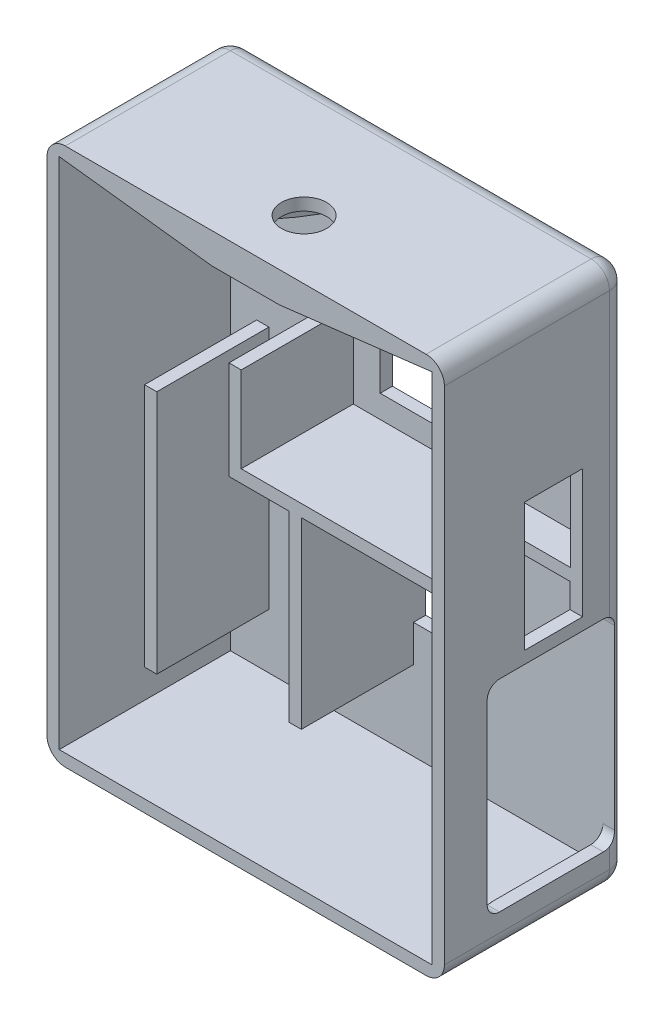
from build123d import *

# Parameters (mm, degrees)
SKETCH_1_W               = 65
SKETCH_1_H               = 30
EXTRUDE_1_DEPTH          = 88
SKETCH_4_W               = 2
SKETCH_4_H               = 40
CUT_EXTRUDE_1_DEPTH      = 28
CUT_EXTRUDE_2_DEPTH      = 6
SKETCH_7_W               = 4.182275868
SKETCH_7_H               = 9
CUT_EXTRUDE_3_DEPTH      = 6
SKETCH_8_W               = 12
SKETCH_8_H               = 11
CUT_EXTRUDE_4_DEPTH      = 6
FILLET_1_R               = 3
CUT_EXTRUDE_5_DEPTH      = 3
CUT_EXTRUDE_6_DEPTH      = 15
CUT_EXTRUDE_6_DEPTH_BACK = 6
SKETCH_12_W              = 10
SKETCH_12_H              = 9.5034376
CUT_EXTRUDE_8_DEPTH      = 5
CUT_EXTRUDE_8_DEPTH_BACK = 10
SKETCH_18_R              = 3.7
SKETCH_19_W              = 9.664954626
SKETCH_19_H              = 76.096771223
CUT_EXTRUDE_9_DEPTH      = 61


with BuildPart() as part:
    # 草图1 → 凸台-拉伸1 (new body)
    with BuildSketch(Plane(origin=(0, 0, 0), x_dir=(1, 0, 0), z_dir=(0, 1, 0))):
        Rectangle(SKETCH_1_W, SKETCH_1_H)
    extrude(amount=EXTRUDE_1_DEPTH)

    # 草图4 → 切除-拉伸1 (cut)
    with BuildSketch(Plane.XY.offset(15)):
        Polygon((-30.5, 86), (-30.5, 2), (-18.5, 2), (-9.5, 2), (30.439417497, 2), (30.439417497, 45), (-0.560582503, 45), (-0.560582503, 15), (-2.560582503, 15), (-2.560582503, 44.909852699), (-12.396150881, 44.909852699), (-12.396150881, 61), (-10.396150881, 61), (-10.396150881, 47), (24.5, 47), (30.5, 47), (30.5, 48.635726891), (30.5, 59.903593532), (30.5, 86), (5.5, 83), (-5.5, 83), align=None)
        with Locations((-25.206585503, 31)):
            Rectangle(SKETCH_4_W, SKETCH_4_H, mode=Mode.SUBTRACT)
    extrude(amount=-CUT_EXTRUDE_1_DEPTH, mode=Mode.SUBTRACT)

    # 草图6 → 切除-拉伸2 (cut)
    with BuildSketch(Plane(origin=(32.5, 0, 0), x_dir=(0, 0, -1), z_dir=(1, 0, 0))):
        with BuildLine():
            Line((13, 37), (13, 8))
            ThreePointArc((13, 8), (12.414213562, 6.585786438), (11, 6))
            Line((11, 6), (-6, 6))
            ThreePointArc((-6, 6), (-7.414213562, 6.585786438), (-8, 8))
            Line((-8, 8), (-8, 37))
            ThreePointArc((-8, 37), (-7.414213562, 38.414213562), (-6, 39))
            Line((-6, 39), (11, 39))
            ThreePointArc((11, 39), (12.414213562, 38.414213562), (13, 37))
        make_face()
    extrude(amount=-CUT_EXTRUDE_2_DEPTH, mode=Mode.SUBTRACT)

    # 草图7 → 切除-拉伸3 (cut)
    with BuildSketch(Plane.XY.offset(-13)):
        with Locations((1.530555431, 25.5)):
            Rectangle(SKETCH_7_W, SKETCH_7_H)
    extrude(amount=-CUT_EXTRUDE_3_DEPTH, mode=Mode.SUBTRACT)

    # 草图8 → 切除-拉伸4 (cut)
    with BuildSketch(Plane.XY.offset(-13)):
        with Locations((0, 56.224480757)):
            Rectangle(SKETCH_8_W, SKETCH_8_H)
    extrude(amount=-CUT_EXTRUDE_4_DEPTH, mode=Mode.SUBTRACT)

    # 圆角1
    # the kernel refuses this fillet: 3 mm, written as the material it takes off along each edge
    with BuildSketch(Plane(origin=(29.5, 3, -12), x_dir=(0, -1, 0), z_dir=(0, 0, -1))) as fillet_1_piece_1_section:
        Polygon((0, 0), (FILLET_1_R, 0), (FILLET_1_R, -FILLET_1_R), (0, -FILLET_1_R), align=None)
    fillet_1_piece_1 = extrude(amount=FILLET_1_R, mode=Mode.PRIVATE)
    fillet_1_piece_1 = fillet_1_piece_1 - Plane(origin=(29.5, 3, -12), x_dir=(-0.7071067811865475, 0.7071067811865475, 0), z_dir=(0, 0, -1)) * Sphere(FILLET_1_R, mode=Mode.PRIVATE)
    add(fillet_1_piece_1, mode=Mode.SUBTRACT)
    with BuildSketch(Plane(origin=(29.5, 85, -12), x_dir=(0, 1, 0), z_dir=(0, 0, -1))) as fillet_1_piece_2_section:
        Polygon((0, 0), (FILLET_1_R, 0), (FILLET_1_R, FILLET_1_R), (0, FILLET_1_R), align=None)
    fillet_1_piece_2 = extrude(amount=FILLET_1_R, mode=Mode.PRIVATE)
    fillet_1_piece_2 = fillet_1_piece_2 - Plane(origin=(29.5, 85, -12), x_dir=(-0.7071067811865475, -0.7071067811865475, 0), z_dir=(0, 0, -1)) * Sphere(FILLET_1_R, mode=Mode.PRIVATE)
    add(fillet_1_piece_2, mode=Mode.SUBTRACT)
    with BuildSketch(Plane(origin=(-29.5, 3, -12), x_dir=(-1, 0, 0), z_dir=(0, 0, -1))) as fillet_1_piece_3_section:
        Polygon((0, 0), (FILLET_1_R, 0), (FILLET_1_R, -FILLET_1_R), (0, -FILLET_1_R), align=None)
    fillet_1_piece_3 = extrude(amount=FILLET_1_R, mode=Mode.PRIVATE)
    fillet_1_piece_3 = fillet_1_piece_3 - Plane(origin=(-29.5, 3, -12), x_dir=(0.7071067811865475, 0.7071067811865475, 0), z_dir=(0, 0, -1)) * Sphere(FILLET_1_R, mode=Mode.PRIVATE)
    add(fillet_1_piece_3, mode=Mode.SUBTRACT)
    with BuildSketch(Plane(origin=(-29.5, 85, -12), x_dir=(-1, 0, 0), z_dir=(0, 0, -1))) as fillet_1_piece_4_section:
        Polygon((0, 0), (FILLET_1_R, 0), (FILLET_1_R, FILLET_1_R), (0, FILLET_1_R), align=None)
    fillet_1_piece_4 = extrude(amount=FILLET_1_R, mode=Mode.PRIVATE)
    fillet_1_piece_4 = fillet_1_piece_4 - Plane(origin=(-29.5, 85, -12), x_dir=(0.7071067811865475, -0.7071067811865475, 0), z_dir=(0, 0, -1)) * Sphere(FILLET_1_R, mode=Mode.PRIVATE)
    add(fillet_1_piece_4, mode=Mode.SUBTRACT)
    with BuildSketch(Plane(origin=(32.5, 3, -15), x_dir=(-1, 0, 0), z_dir=(0, 1, 0))) as fillet_1_piece_5:
        with BuildLine():
            CenterArc((FILLET_1_R, FILLET_1_R), FILLET_1_R, 180, 90)
            Line((0, FILLET_1_R), (0, 0))
            Line((0, 0), (FILLET_1_R, 0))
        make_face()
    extrude(amount=82, mode=Mode.SUBTRACT)
    with BuildSketch(Plane(origin=(-32.5, 3, -15), x_dir=(1, 0, 0), z_dir=(0, 1, 0))) as fillet_1_piece_6:
        with BuildLine():
            CenterArc((FILLET_1_R, -FILLET_1_R), FILLET_1_R, 90, 90)
            Line((0, -FILLET_1_R), (0, 0))
            Line((0, 0), (FILLET_1_R, 0))
        make_face()
    extrude(amount=82, mode=Mode.SUBTRACT)
    with BuildSketch(Plane(origin=(-32.5, 0, 22.5), x_dir=(0, 1, 0), z_dir=(0, 0, -1)), Plane(origin=(32.5, 88, -12), x_dir=(-1, 0, 0), z_dir=(0, 0, 1))) as fillet_1_piece_7:
        with BuildLine():
            CenterArc((FILLET_1_R, FILLET_1_R), FILLET_1_R, 180, 90)
            Line((0, FILLET_1_R), (0, 0))
            Line((0, 0), (FILLET_1_R, 0))
        make_face()
    extrude(amount=34.5, mode=Mode.SUBTRACT)
    with BuildSketch(Plane(origin=(32.5, 0, -12), x_dir=(-1, 0, 0), z_dir=(0, 0, 1)), Plane(origin=(-32.5, 88, 22.5), x_dir=(0, -1, 0), z_dir=(0, 0, -1))) as fillet_1_piece_8:
        with BuildLine():
            CenterArc((FILLET_1_R, -FILLET_1_R), FILLET_1_R, 90, 90)
            Line((0, -FILLET_1_R), (0, 0))
            Line((0, 0), (FILLET_1_R, 0))
        make_face()
    extrude(amount=34.5, mode=Mode.SUBTRACT)
    with BuildSketch(Plane(origin=(-29.5, 0, -15), x_dir=(0, 1, 0), z_dir=(1, 0, 0))) as fillet_1_piece_9:
        with BuildLine():
            CenterArc((FILLET_1_R, FILLET_1_R), FILLET_1_R, 180, 90)
            Line((0, FILLET_1_R), (0, 0))
            Line((0, 0), (FILLET_1_R, 0))
        make_face()
    extrude(amount=59, mode=Mode.SUBTRACT)
    with BuildSketch(Plane(origin=(-29.5, 88, -15), x_dir=(0, -1, 0), z_dir=(1, 0, 0))) as fillet_1_piece_10:
        with BuildLine():
            CenterArc((FILLET_1_R, -FILLET_1_R), FILLET_1_R, 90, 90)
            Line((0, -FILLET_1_R), (0, 0))
            Line((0, 0), (FILLET_1_R, 0))
        make_face()
    extrude(amount=59, mode=Mode.SUBTRACT)

    # 草图10 → 切除-拉伸5 (cut)
    with BuildSketch(Plane.XZ.offset(-83)):
        Polygon((3.993436667, -1.290973026), (7.651958762, 5.591266151), (3.521025848, 12.200758813), (-4.268429161, 11.9280123), (-7.926951256, 5.045773123), (-3.796018342, -1.563719539), align=None)
    extrude(amount=-CUT_EXTRUDE_5_DEPTH, mode=Mode.SUBTRACT)

    # 草图12 → 切除-拉伸6 (cut, two sides: drawn at the far end of the back side and taken through both)
    with BuildSketch(Plane(origin=(0, 47, 0), x_dir=(1, 0, 0), z_dir=(0, 1, 0)).offset(-CUT_EXTRUDE_6_DEPTH_BACK)):
        with Locations((27.504184345, 2.8493686)):
            Rectangle(SKETCH_12_W, SKETCH_12_H)
    extrude(amount=CUT_EXTRUDE_6_DEPTH + CUT_EXTRUDE_6_DEPTH_BACK, mode=Mode.SUBTRACT)

    # 草图18 → 切除-拉伸8 (cut, two sides: drawn at the far end of the back side and taken through both)
    with BuildSketch(Plane.XZ.offset(-83).offset(-CUT_EXTRUDE_8_DEPTH_BACK)):
        with Locations(Location((-0.137496247, 5.318519637, 0), (0, 0, 90))):
            Circle(SKETCH_18_R)
    extrude(amount=CUT_EXTRUDE_8_DEPTH + CUT_EXTRUDE_8_DEPTH_BACK, mode=Mode.SUBTRACT)

    # 草图19 → 切除-拉伸9 (cut)
    with BuildSketch(Plane(origin=(-30.5, 0, 0), x_dir=(0, 0, -1), z_dir=(1, 0, 0))):
        with Locations((-10.167522687, 40.608730848)):
            Rectangle(SKETCH_19_W, SKETCH_19_H)
    extrude(amount=CUT_EXTRUDE_9_DEPTH, mode=Mode.SUBTRACT)


solid = part.part
